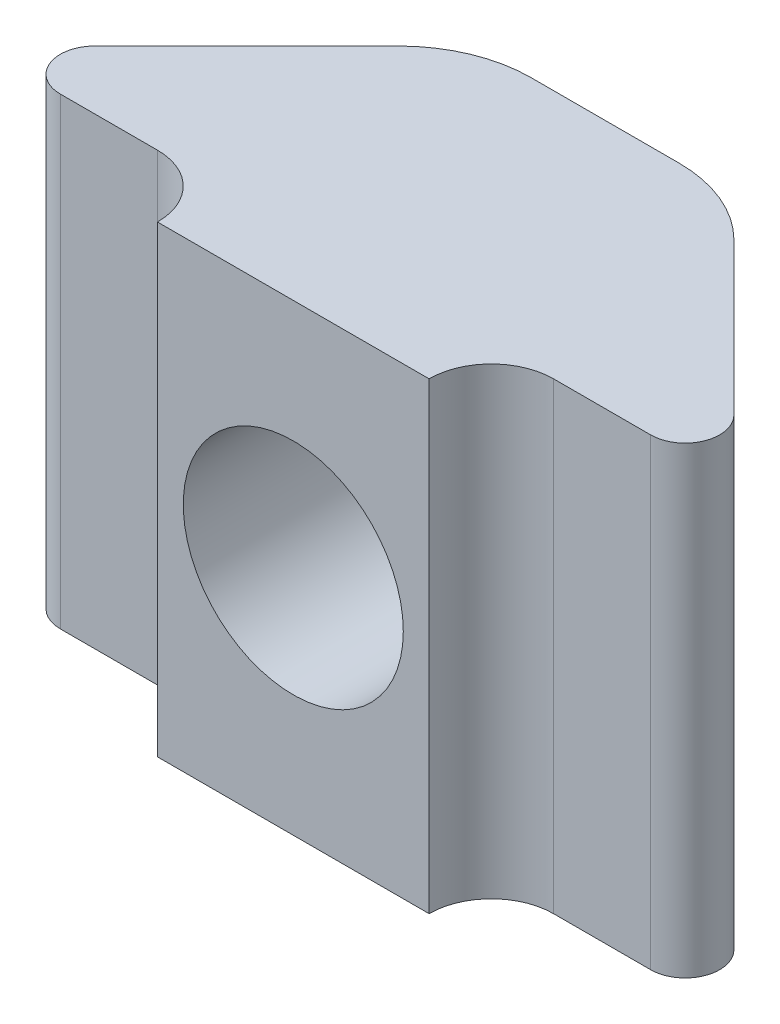
from build123d import *

# Parameters (mm, degrees)
BOSS_EXTRUDE1_DEPTH = 10.16
SKETCH2_R           = 2.413
CUT_EXTRUDE1_DEPTH  = 15.222728745


with BuildPart() as part:
    # Sketch1 → Boss-Extrude1 (new body)
    with BuildSketch(Plane(origin=(0, 0, 0), x_dir=(1, 0, 0), z_dir=(0, 1, 0))):
        with BuildLine():
            Line((-2.9785, -6.8393), (2.978499971, -6.8393))
            ThreePointArc((2.978499971, -6.8393), (3.378269925, -5.874169954), (4.343399971, -5.4744))
            Line((4.343399971, -5.4744), (6.474794456, -5.4744))
            ThreePointArc((6.474794456, -5.4744), (7.173247382, -5.007708675), (7.009367182, -4.183827273))
            Line((7.009367182, -4.183827273), (3.679323642, -0.853783733))
            ThreePointArc((3.679323642, -0.853783733), (2.73362958, -0.221891163), (1.618107374, 0))
            Line((1.618107374, 0), (-1.618107374, 0))
            ThreePointArc((-1.618107374, 0), (-2.73362958, -0.221891163), (-3.679323642, -0.853783733))
            Line((-3.679323642, -0.853783733), (-7.009367182, -4.183827273))
            ThreePointArc((-7.009367182, -4.183827273), (-7.173247382, -5.007708675), (-6.474794456, -5.4744))
            Line((-6.474794456, -5.4744), (-4.3434, -5.4744))
            ThreePointArc((-4.3434, -5.4744), (-3.378269954, -5.874169954), (-2.9785, -6.8393))
        make_face()
    extrude(amount=BOSS_EXTRUDE1_DEPTH)

    # Sketch2 → Cut-Extrude1 (cut, through all)
    with BuildSketch(Plane.XY.offset(6.8393)):
        with Locations((-1.4e-08, 5.08)):
            Circle(SKETCH2_R)
    extrude(amount=-CUT_EXTRUDE1_DEPTH, mode=Mode.SUBTRACT)


solid = part.part
